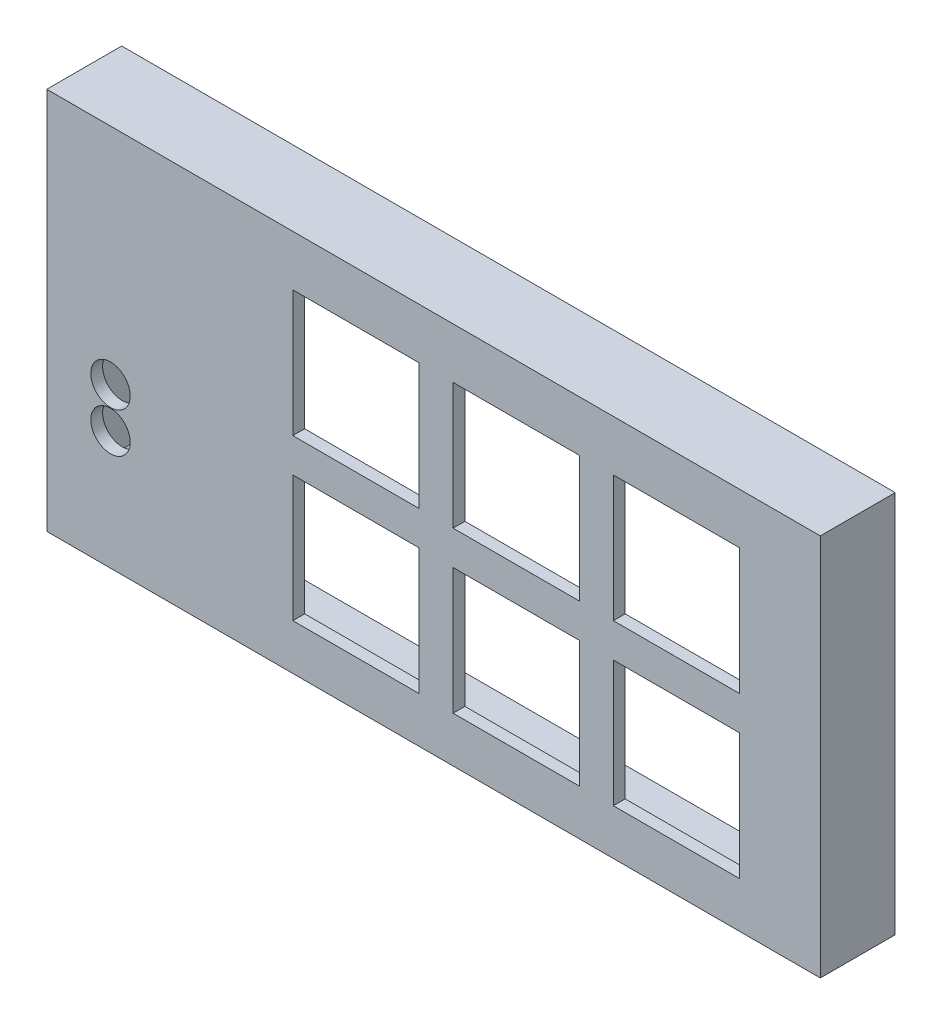
from build123d import *

# Parameters (mm, degrees)
SKETCH3_W       = 98.075
SKETCH3_H       = 48.545
SKETCH3_W_2     = 95.075
SKETCH3_H_2     = 45.545
WALL_DEPTH      = 9.5
SKETCH4_W       = 98.075
SKETCH4_H       = 48.545
TOPFACE_DEPTH   = 1.5
SKETCH7_R       = 3
STANDOFFS_DEPTH = 8
SKETCH5_R       = 2.5
SKETCH5_W       = 16
SKETCH5_H       = 16
KEYCUT_DEPTH    = 210.569889118


with BuildPart() as part:
    # Sketch3 → Wall (new body)
    with BuildSketch(Plane.XY.offset(1.5)):
        with Locations((111.4425, -110.1725)):
            Rectangle(SKETCH3_W, SKETCH3_H)
        with Locations((111.4425, -110.1725)):
            Rectangle(SKETCH3_W_2, SKETCH3_H_2, mode=Mode.SUBTRACT)
    extrude(amount=WALL_DEPTH)

    # Sketch4 → TopFace (add)
    with BuildSketch(Plane.XY.offset(11)):
        with Locations((111.4425, -110.1725)):
            Rectangle(SKETCH4_W, SKETCH4_H)
    extrude(amount=-TOPFACE_DEPTH)

    # Sketch7 → Standoffs (add)
    with BuildSketch(Plane(origin=(0, 0, 9.5), x_dir=(-1, 0, 0), z_dir=(0, 0, -1))):
        with Locations((-153.035, -93.345)):
            Circle(SKETCH7_R)
        with Locations((-69.85, -93.98)):
            Circle(SKETCH7_R)
        with Locations((-69.85, -127)):
            Circle(SKETCH7_R)
        with Locations((-153.035, -127)):
            Circle(SKETCH7_R)
    extrude(amount=STANDOFFS_DEPTH)

    # Sketch5 → KeyCut (cut, through all)
    with BuildSketch(Plane.XY.offset(11)):
        with Locations((70.485, -114.3)):
            Circle(SKETCH5_R)
        with Locations((70.485, -119.38)):
            Circle(SKETCH5_R)
        with Locations((142.24, -120.65)):
            Rectangle(SKETCH5_W, SKETCH5_H)
        with Locations((121.92, -120.65)):
            Rectangle(SKETCH5_W, SKETCH5_H)
        with Locations((101.6, -120.65)):
            Rectangle(SKETCH5_W, SKETCH5_H)
        with Locations((101.6, -100.33)):
            Rectangle(SKETCH5_W, SKETCH5_H)
        with Locations((142.24, -100.33)):
            Rectangle(SKETCH5_W, SKETCH5_H)
        with Locations((121.92, -100.33)):
            Rectangle(SKETCH5_W, SKETCH5_H)
    extrude(amount=-KEYCUT_DEPTH, mode=Mode.SUBTRACT)


solid = part.part
